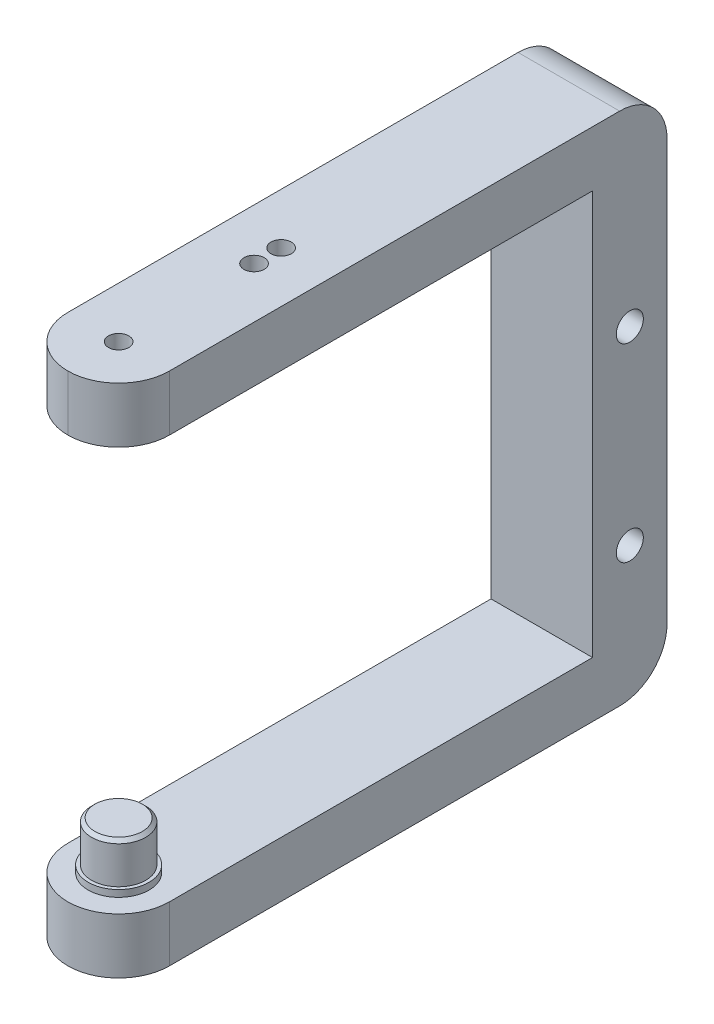
from build123d import *

# Parameters (mm, degrees)
SCHIZZO1_W                   = 15
SCHIZZO1_H                   = 76.1
ESTRUSIONE_ESTRUSIONE1_DEPTH = 11
SCHIZZO2_W                   = 15
SCHIZZO2_H                   = 8.2
ESTRUSIONE_ESTRUSIONE2_DEPTH = 62.5
SCHIZZO3_R                   = 7.5
ESTRUSIONE_ESTRUSIONE3_DEPTH = 8.2
SCHIZZO4_R                   = 4
ESTRUSIONE_ESTRUSIONE4_DEPTH = 7
SMUSSO1_SIZE                 = 0.5
SCHIZZO5_W                   = 15
SCHIZZO5_H                   = 8.2
ESTRUSIONE_ESTRUSIONE5_DEPTH = 70
F_3_0_3_DIAMETER_HOLE1_D     = 3
F_3_0_3_DIAMETER_HOLE1_DEPTH = 10
F_3_0_3_DIAMETER_HOLE1_TIP   = 0.901290929
RACCORDO1_R                  = 7.5
RACCORDO2_R                  = 7
F_4_0_4_DIAMETER_HOLE1_D     = 4
SCHIZZO12_R                  = 4.5
ESTRUSIONE_ESTRUSIONE6_DEPTH = 1
F_3_0_3_DIAMETER_HOLE2_D     = 3
F_3_0_3_DIAMETER_HOLE2_DEPTH = 8.2


with BuildPart() as part:
    # Schizzo1 → Estrusione-Estrusione1 (new body)
    with BuildSketch(Plane.XY):
        with Locations((7.5, 38.05)):
            Rectangle(SCHIZZO1_W, SCHIZZO1_H)
    extrude(amount=ESTRUSIONE_ESTRUSIONE1_DEPTH)

    # Schizzo2 → Estrusione-Estrusione2 (add)
    with BuildSketch(Plane.XY.offset(11)):
        with Locations((7.5, 4.1)):
            Rectangle(SCHIZZO2_W, SCHIZZO2_H)
    extrude(amount=ESTRUSIONE_ESTRUSIONE2_DEPTH)

    # Schizzo3 → Estrusione-Estrusione3 (add)
    with BuildSketch(Plane(origin=(0, 8.2, 0), x_dir=(1, 0, 0), z_dir=(0, 1, 0))):
        with Locations((7.5, -73.5)):
            Circle(SCHIZZO3_R)
    extrude(amount=-ESTRUSIONE_ESTRUSIONE3_DEPTH)

    # Schizzo4 → Estrusione-Estrusione4 (add)
    with BuildSketch(Plane(origin=(0, 8.2, 0), x_dir=(1, 0, 0), z_dir=(0, 1, 0))):
        with Locations(Location((7.5, -73.5, 0), (0, 0, 90))):
            Circle(SCHIZZO4_R)
    extrude(amount=ESTRUSIONE_ESTRUSIONE4_DEPTH)

    # Smusso1
    smusso1_edges = [part.edges().sort_by_distance(p)[0] for p in [
        (7.5, 15.2, 77.5),
    ]]
    chamfer(smusso1_edges, length=SMUSSO1_SIZE)

    # Schizzo5 → Estrusione-Estrusione5 (add)
    with BuildSketch(Plane.XY.offset(11)):
        with Locations((7.5, 72)):
            Rectangle(SCHIZZO5_W, SCHIZZO5_H)
    extrude(amount=ESTRUSIONE_ESTRUSIONE5_DEPTH)

    # Ø3.0 (3) Diameter Hole1
    with Locations(Plane(origin=(0, 76.1, 0), x_dir=(1, 0, 0), z_dir=(0, 1, 0))):
        with Locations((7.5, -49.5), (7.5, -53.5)):
            Hole(F_3_0_3_DIAMETER_HOLE1_D / 2, depth=F_3_0_3_DIAMETER_HOLE1_DEPTH)
            with Locations((0, 0, -(F_3_0_3_DIAMETER_HOLE1_DEPTH + F_3_0_3_DIAMETER_HOLE1_TIP / 2))):  # 118° drill point
                Cone(0, F_3_0_3_DIAMETER_HOLE1_D / 2, F_3_0_3_DIAMETER_HOLE1_TIP, mode=Mode.SUBTRACT)

    # Raccordo1
    raccordo1_edges = [part.edges().sort_by_distance(p)[0] for p in [
        (15, 72, 81),
        (0, 72, 81),
    ]]
    fillet(raccordo1_edges, radius=RACCORDO1_R - 0.0001)  # a hair under: the kernel refuses the full size

    # Raccordo2
    raccordo2_edges = [part.edges().sort_by_distance(p)[0] for p in [
        (7.5, 76.1, 0),
        (7.5, 0, 0),
    ]]
    fillet(raccordo2_edges, radius=RACCORDO2_R)

    # Ø4.0 (4) Diameter Hole1 (through all)
    with Locations(Plane(origin=(15, 0, 0), x_dir=(0, 0, -1), z_dir=(1, 0, 0))):
        with Locations((-5.5, 19.8), (-5.5, 47.8)):
            Hole(F_4_0_4_DIAMETER_HOLE1_D / 2)

    # Schizzo12 → Estrusione-Estrusione6 (add)
    with BuildSketch(Plane(origin=(0, 8.2, 0), x_dir=(1, 0, 0), z_dir=(0, 1, 0))):
        with Locations(Location((7.5, -73.5, 0), (0, 0, 90))):
            Circle(SCHIZZO12_R)
    extrude(amount=ESTRUSIONE_ESTRUSIONE6_DEPTH)

    # Ø3.0 (3) Diameter Hole2
    with Locations(Plane(origin=(0, 76.1, 0), x_dir=(1, 0, 0), z_dir=(0, 1, 0))):
        with Locations((7.5, -73.5)):
            Hole(F_3_0_3_DIAMETER_HOLE2_D / 2, depth=F_3_0_3_DIAMETER_HOLE2_DEPTH)


solid = part.part
